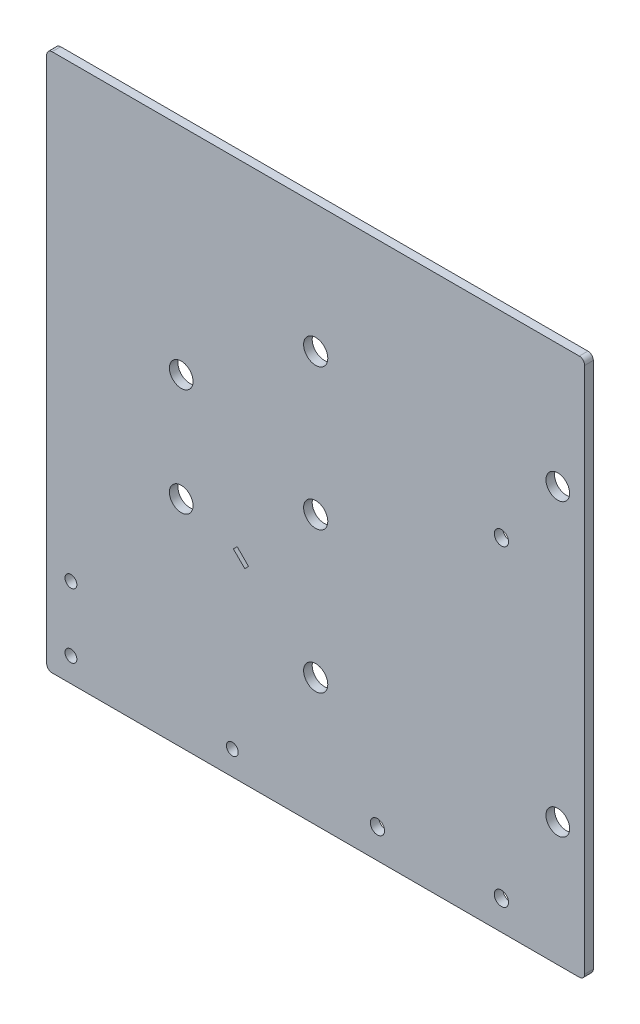
from build123d import *

# Parameters (mm, degrees)
SKETCH1_W           = 100
SKETCH1_H           = 100
BOSS_EXTRUDE1_DEPTH = 1.6
SKETCH3_R           = 2.2479
SKETCH3_R_2         = 1.325
SKETCH3_R_3         = 2.2
SKETCH3_R_4         = 1.1
CUT_EXTRUDE2_DEPTH  = 71.728777736
FILLET1_R           = 1
CUT_EXTRUDE4_DEPTH  = 71.728777736


with BuildPart() as part:
    # Sketch1 → Boss-Extrude1 (new body)
    with BuildSketch(Plane.XY):
        Rectangle(SKETCH1_W, SKETCH1_H)
    extrude(amount=BOSS_EXTRUDE1_DEPTH)

    # Sketch3 → Cut-Extrude2 (cut, through all)
    with BuildSketch(Plane(origin=(0, 0, 1.6), x_dir=(-1, 0, 0), z_dir=(0, 0, -1))):
        with Locations((0, 26.25)):
            Circle(SKETCH3_R)
        Circle(SKETCH3_R)
        with Locations((-34.525, -44.525)):
            Circle(SKETCH3_R_2)
        with Locations((0, -26.25)):
            Circle(SKETCH3_R)
        with Locations((-45, -27)):
            Circle(SKETCH3_R_3)
        with Locations((-45, 27)):
            Circle(SKETCH3_R_3)
        with Locations((-34.525, 13.525)):
            Circle(SKETCH3_R_2)
        with Locations((15.5, -45.5)):
            Circle(SKETCH3_R_4)
        with Locations((45.5, -45.5)):
            Circle(SKETCH3_R_4)
        with Locations((45.5, -33.5)):
            Circle(SKETCH3_R_4)
        with Locations((-11.475, -44.525)):
            Circle(SKETCH3_R_2)
        with Locations((25, -10)):
            Circle(SKETCH3_R_3)
        with Locations((25, 10)):
            Circle(SKETCH3_R_3)
    extrude(amount=CUT_EXTRUDE2_DEPTH, mode=Mode.SUBTRACT)

    # Fillet1
    fillet1_edges = [part.edges().sort_by_distance(p)[0] for p in [
        (-50, -50, 0.8),
        (-50, 50, 0.8),
        (50, -50, 0.8),
        (50, 50, 0.8),
    ]]
    fillet(fillet1_edges, radius=FILLET1_R)

    # Sketch5 → Cut-Extrude4 (cut, through all)
    with BuildSketch(Plane(origin=(0, 0, 0), x_dir=(-1, 0, 0), z_dir=(0, 0, -1))):
        Polygon((12.47704736, -14.598446958), (14.598745506, -12.477504485), (15.305726331, -13.1847372), (13.184028184, -15.305679673), align=None)
    extrude(amount=-CUT_EXTRUDE4_DEPTH, mode=Mode.SUBTRACT)


solid = part.part
